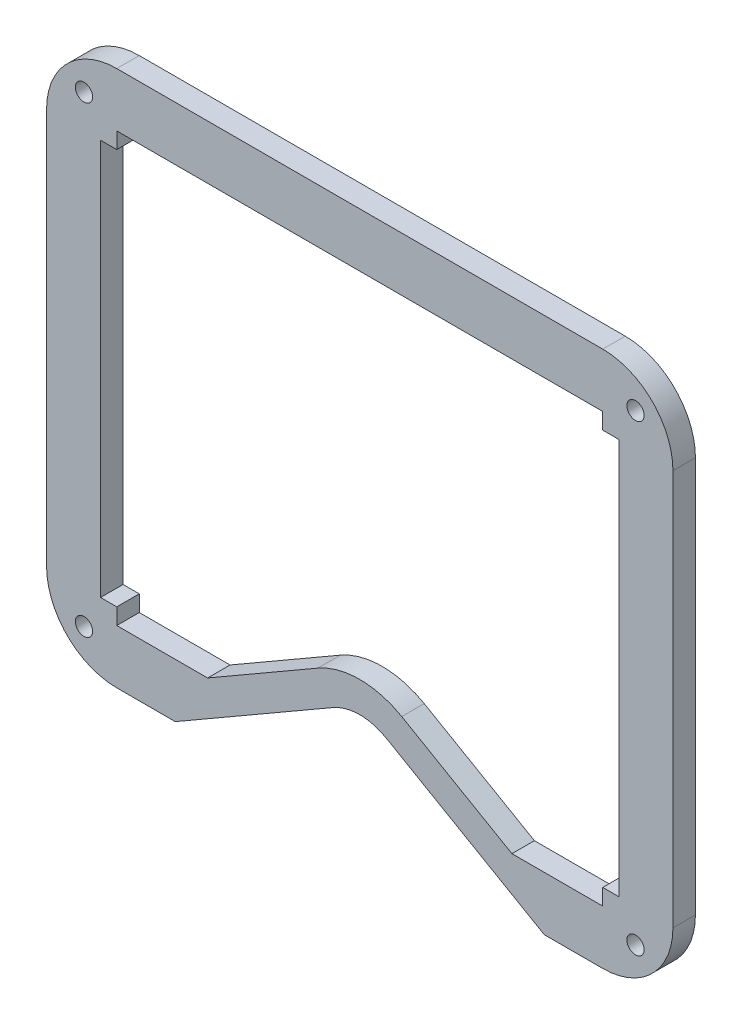
from build123d import *

# Parameters (mm, degrees)
SKETCH1_R           = 0.6096
BOSS_EXTRUDE1_DEPTH = 1.5875


with BuildPart() as part:
    # Sketch1 → Boss-Extrude1 (new body)
    with BuildSketch(Plane.XY):
        with BuildLine():
            ThreePointArc((-22.098, -13.97), (-20.647299887, -17.472299887), (-17.145, -18.923))
            Line((-17.145, -18.923), (-13.017661314, -18.923))
            Line((-13.017661314, -18.923), (-1.8796, -12.492437302))
            ThreePointArc((-1.8796, -12.492437302), (0, -11.9888), (1.8796, -12.492437302))
            Line((1.8796, -12.492437302), (13.017661314, -18.923))
            Line((13.017661314, -18.923), (17.145, -18.923))
            ThreePointArc((17.145, -18.923), (20.647299887, -17.472299887), (22.098, -13.97))
            Line((22.098, -13.97), (22.098, 13.97))
            ThreePointArc((22.098, 13.97), (20.647299887, 17.472299887), (17.145, 18.923))
            Line((17.145, 18.923), (-17.145, 18.923))
            ThreePointArc((-17.145, 18.923), (-20.647299887, 17.472299887), (-22.098, 13.97))
            Line((-22.098, 13.97), (-22.098, -13.97))
        make_face()
        with Locations((-19.457528855, -16.326805286)):
            Circle(SKETCH1_R, mode=Mode.SUBTRACT)
        with Locations((19.457528855, -16.326805286)):
            Circle(SKETCH1_R, mode=Mode.SUBTRACT)
        with Locations((-19.457528855, 16.326805286)):
            Circle(SKETCH1_R, mode=Mode.SUBTRACT)
        with BuildLine():
            Line((-18.288, -13.97), (-18.288, 13.97))
            Line((-18.288, 13.97), (-17.145, 13.97))
            Line((-17.145, 13.97), (-17.145, 15.113))
            Line((-17.145, 15.113), (17.145, 15.113))
            Line((17.145, 15.113), (17.145, 13.97))
            Line((17.145, 13.97), (18.288, 13.97))
            Line((18.288, 13.97), (18.288, -13.97))
            Line((18.288, -13.97), (17.145, -13.97))
            Line((17.145, -13.97), (17.145, -15.113))
            Line((17.145, -15.113), (10.736547737, -15.113))
            Line((10.736547737, -15.113), (2.9591, -10.622688455))
            ThreePointArc((2.9591, -10.622688455), (0, -9.8298), (-2.9591, -10.622688455))
            Line((-2.9591, -10.622688455), (-10.736547737, -15.113))
            Line((-10.736547737, -15.113), (-17.145, -15.113))
            Line((-17.145, -15.113), (-17.145, -13.97))
            Line((-17.145, -13.97), (-18.288, -13.97))
        make_face(mode=Mode.SUBTRACT)
        with Locations((19.457528855, 16.326805286)):
            Circle(SKETCH1_R, mode=Mode.SUBTRACT)
    extrude(amount=BOSS_EXTRUDE1_DEPTH)


solid = part.part
